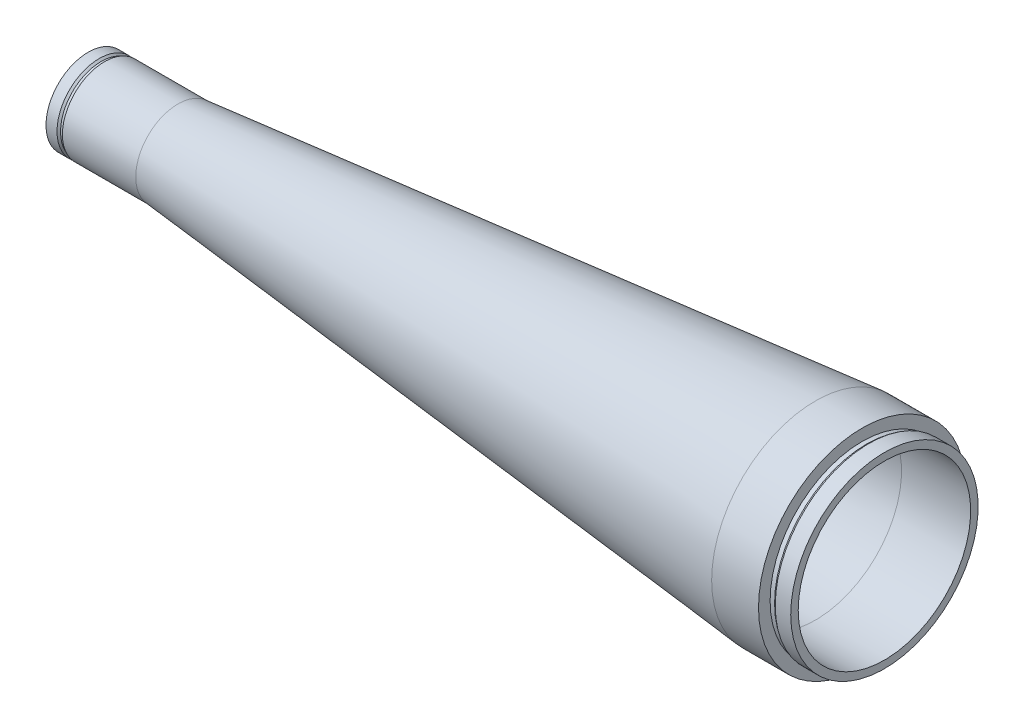
from build123d import *


with BuildPart() as part:
    # Skica1 → Rotovat1 (revolve)
    with BuildSketch(Plane.XY):
        Polygon((-36.713340937, -44.25), (-56.713340937, -44.25), (-328.75, -18), (-360.05, -18), (-360.05, -17.3), (-361.55, -17.3), (-362.35, -18), (-367.05, -18), (-367.05, -15.5), (-345.05, -15.5), (-325.964213562, -15.5), (-324.964213562, -16.5), (-323.75, -16.5), (-323.75, -15.4), (-322.05, -15.4), (-322.05, -12.9), (-217.05, -23.4), (-217.05, -25.4), (-215.55, -25.4), (-215.55, -26.9), (-213.932233047, -26.9), (-212.632233047, -25.6), (-117.05, -29.4), (-117.05, -33.4), (-115.55, -33.4), (-115.55, -34.5), (-113.1872583, -34.5), (-112.099684413, -33.412426112), (-56.713340937, -36.8), (-27.213340937, -36.8), (-27.213340937, -40), (-33.813340937, -40), (-34.813340937, -39.3), (-36.713340937, -39.3), align=None)
    revolve(axis=Axis((-172.442437001, 0, 0), (1, 0, 0)))


solid = part.part
